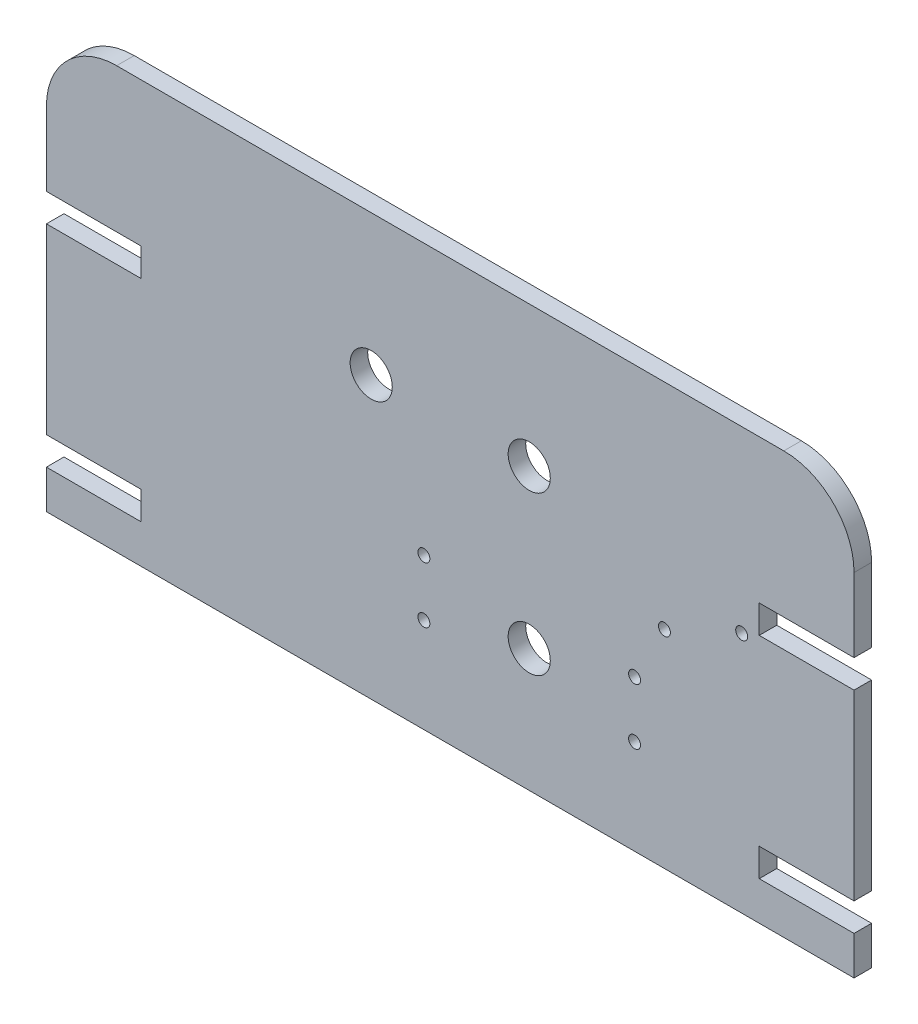
from build123d import *

# Parameters (mm, degrees)
SKETCH1_W            = 230
SKETCH1_H            = 120
BOSS_EXTRUDE1_DEPTH  = 5
CUT_EXTRUDE1_REACH   = 131.808
SKETCH2_W            = 27
SKETCH2_H            = 8.000000001
CUT_EXTRUDE2_REACH   = 131.808
SKETCH3_R            = 6
M3_CLEARANCE_HOLE1_D = 3.4
FILLET1_R            = 20
CUT_EXTRUDE3_REACH   = 131.808
SKETCH7_R            = 1.7


with BuildPart() as part:
    # Sketch1 → Boss-Extrude1 (new body)
    with BuildSketch(Plane.XY):
        Rectangle(SKETCH1_W, SKETCH1_H)
    extrude(amount=BOSS_EXTRUDE1_DEPTH)

    # Sketch2 → Cut-Extrude1 (cut, up to next)
    with BuildSketch(Plane(origin=(0, 0, 0), x_dir=(-1, 0, 0), z_dir=(0, 0, -1)), mode=Mode.PRIVATE) as cut_extrude1_sk1:
        with Locations((101.5, 15.000000001)):
            Rectangle(SKETCH2_W, SKETCH2_H)
    cut_extrude1_tool1 = extrude(cut_extrude1_sk1.sketch, amount=-CUT_EXTRUDE1_REACH, mode=Mode.PRIVATE) & part.part
    # Sketch2 → Cut-Extrude1 (cut, up to next)
    with BuildSketch(Plane(origin=(0, 0, 0), x_dir=(-1, 0, 0), z_dir=(0, 0, -1)), mode=Mode.PRIVATE) as cut_extrude1_sk2:
        with Locations((101.5, -45.000000001)):
            Rectangle(SKETCH2_W, SKETCH2_H)
    cut_extrude1_tool2 = extrude(cut_extrude1_sk2.sketch, amount=-CUT_EXTRUDE1_REACH, mode=Mode.PRIVATE) & part.part
    # Sketch2 → Cut-Extrude1 (cut, up to next)
    with BuildSketch(Plane(origin=(0, 0, 0), x_dir=(-1, 0, 0), z_dir=(0, 0, -1)), mode=Mode.PRIVATE) as cut_extrude1_sk3:
        with Locations((-101.5, -45.000000001)):
            Rectangle(SKETCH2_W, SKETCH2_H)
    cut_extrude1_tool3 = extrude(cut_extrude1_sk3.sketch, amount=-CUT_EXTRUDE1_REACH, mode=Mode.PRIVATE) & part.part
    # Sketch2 → Cut-Extrude1 (cut, up to next)
    with BuildSketch(Plane(origin=(0, 0, 0), x_dir=(-1, 0, 0), z_dir=(0, 0, -1)), mode=Mode.PRIVATE) as cut_extrude1_sk4:
        with Locations((-101.5, 15.000000001)):
            Rectangle(SKETCH2_W, SKETCH2_H)
    cut_extrude1_tool4 = extrude(cut_extrude1_sk4.sketch, amount=-CUT_EXTRUDE1_REACH, mode=Mode.PRIVATE) & part.part
    add(cut_extrude1_tool1.solids().sort_by_distance((-101.5, 15, 0))[0], mode=Mode.SUBTRACT)
    add(cut_extrude1_tool2.solids().sort_by_distance((-101.5, -45, 0))[0], mode=Mode.SUBTRACT)
    add(cut_extrude1_tool3.solids().sort_by_distance((101.5, -45, 0))[0], mode=Mode.SUBTRACT)
    add(cut_extrude1_tool4.solids().sort_by_distance((101.5, 15, 0))[0], mode=Mode.SUBTRACT)

    # Sketch3 → Cut-Extrude2 (cut, up to next)
    with BuildSketch(Plane.XY.offset(5), mode=Mode.PRIVATE) as cut_extrude2_sk1:
        with Locations((22.5, 20)):
            Circle(SKETCH3_R)
    cut_extrude2_tool1 = extrude(cut_extrude2_sk1.sketch, amount=-CUT_EXTRUDE2_REACH, mode=Mode.PRIVATE) & part.part
    # Sketch3 → Cut-Extrude2 (cut, up to next)
    with BuildSketch(Plane.XY.offset(5), mode=Mode.PRIVATE) as cut_extrude2_sk2:
        with Locations((-22.5, 20)):
            Circle(SKETCH3_R)
    cut_extrude2_tool2 = extrude(cut_extrude2_sk2.sketch, amount=-CUT_EXTRUDE2_REACH, mode=Mode.PRIVATE) & part.part
    # Sketch3 → Cut-Extrude2 (cut, up to next)
    with BuildSketch(Plane.XY.offset(5), mode=Mode.PRIVATE) as cut_extrude2_sk3:
        with Locations((22.5, -25)):
            Circle(SKETCH3_R)
    cut_extrude2_tool3 = extrude(cut_extrude2_sk3.sketch, amount=-CUT_EXTRUDE2_REACH, mode=Mode.PRIVATE) & part.part
    add(cut_extrude2_tool1.solids().sort_by_distance((22.5, 20, 5))[0], mode=Mode.SUBTRACT)
    add(cut_extrude2_tool2.solids().sort_by_distance((-22.5, 20, 5))[0], mode=Mode.SUBTRACT)
    add(cut_extrude2_tool3.solids().sort_by_distance((22.5, -25, 5))[0], mode=Mode.SUBTRACT)

    # M3 Clearance Hole1 (through all)
    with Locations(Plane(origin=(-7.5, -17, 5), x_dir=(1, 0, 0), z_dir=(0, 0, 1))):
        with Locations((0, 0), (60, 0), (60, -16), (0, -16)):
            Hole(M3_CLEARANCE_HOLE1_D / 2)

    # Fillet1
    fillet1_edges = [part.edges().sort_by_distance(p)[0] for p in [
        (115, 60, 2.5),
        (-115, 60, 2.5),
    ]]
    fillet(fillet1_edges, radius=FILLET1_R)

    # Sketch7 → Cut-Extrude3 (cut, up to next)
    with BuildSketch(Plane.XY.offset(5), mode=Mode.PRIVATE) as cut_extrude3_sk1:
        with Locations((61, -1)):
            Circle(SKETCH7_R)
    cut_extrude3_tool1 = extrude(cut_extrude3_sk1.sketch, amount=-CUT_EXTRUDE3_REACH, mode=Mode.PRIVATE) & part.part
    # Sketch7 → Cut-Extrude3 (cut, up to next)
    with BuildSketch(Plane.XY.offset(5), mode=Mode.PRIVATE) as cut_extrude3_sk2:
        with Locations((83, 9)):
            Circle(SKETCH7_R)
    cut_extrude3_tool2 = extrude(cut_extrude3_sk2.sketch, amount=-CUT_EXTRUDE3_REACH, mode=Mode.PRIVATE) & part.part
    add(cut_extrude3_tool1.solids().sort_by_distance((61, -1, 5))[0], mode=Mode.SUBTRACT)
    add(cut_extrude3_tool2.solids().sort_by_distance((83, 9, 5))[0], mode=Mode.SUBTRACT)


solid = part.part
